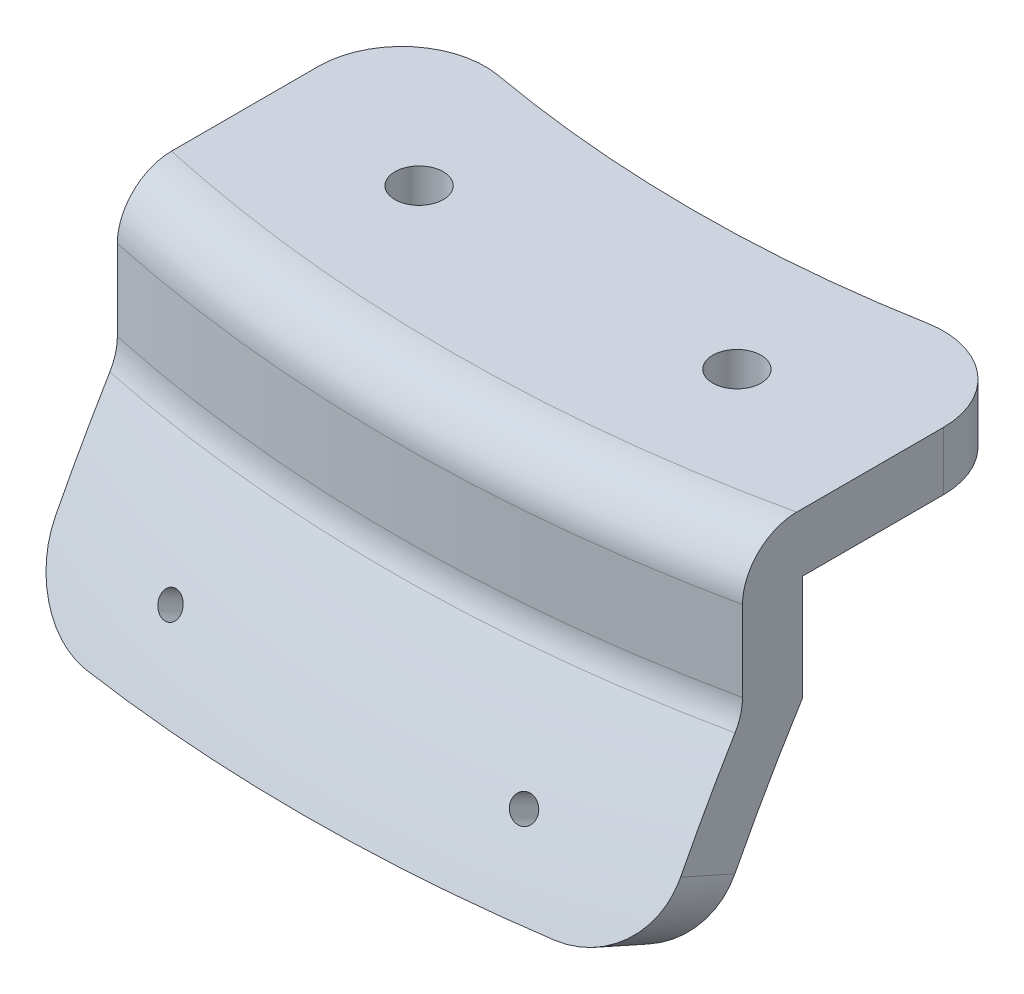
from build123d import *

# Parameters (mm, degrees)
REVOLVE1_ANGLE      = 30
FILLET1_R           = 6.35
SKETCH3_R           = 2.9
CUT_EXTRUDE1_DEPTH  = 203.397131238
SKETCH4_OUTSIDE_W   = 125.116
SKETCH4_OUTSIDE_H   = 77.698
SKETCH4_OUTSIDE_W_2 = 74.947346354
SKETCH4_OUTSIDE_H_2 = 51.780385927
CUT_EXTRUDE2_DEPTH  = 203.397131238
FILLET2_R           = 10


with BuildPart() as part:
    # Sketch2 → Revolve1 (revolve, symmetric)
    with BuildSketch(Plane(origin=(0, 0, 0), x_dir=(0, 0, -1), z_dir=(1, 0, 0))) as revolve1_sk:
        with BuildLine():
            Line((-173.36215491, 191.568849685), (-173.36215491, 178.868849685))
            ThreePointArc((-173.36215491, 178.868849685), (-179.659860551, 167.80435792), (-185.252314729, 156.367202215))
            Line((-185.252314729, 156.367202215), (-191.634038169, 159.243589868))
            ThreePointArc((-191.634038169, 159.243589868), (-186.310738837, 170.195769136), (-180.36215491, 180.821308922))
            Line((-180.36215491, 180.821308922), (-180.36215491, 198.568849685))
            Line((-180.36215491, 198.568849685), (-144.78715491, 198.568849685))
            Line((-144.78715491, 198.568849685), (-144.78715491, 191.568849685))
            Line((-144.78715491, 191.568849685), (-173.36215491, 191.568849685))
        make_face()
    revolve(axis=Axis((0, 72.869777778, 0), (0, 1, 0)), revolution_arc=REVOLVE1_ANGLE / 2)
    revolve(revolve1_sk.sketch, axis=Axis((0, 72.869777778, 0), (0, -1, 0)), revolution_arc=REVOLVE1_ANGLE / 2)

    # Fillet1
    fillet1_edges = [part.edges().sort_by_distance(p)[0] for p in [
        (0, 180.821308922, 180.36215491),
        (0, 198.568849685, 180.36215491),
    ]]
    fillet(fillet1_edges, radius=FILLET1_R)

    # Sketch3 → Cut-Extrude1 (cut, through all)
    with BuildSketch(Plane.XZ.offset(-198.568849685)):
        with Locations((19.05, 158.674245572)):
            Circle(SKETCH3_R)
        with Locations((-19.05, 158.674245572)):
            Circle(SKETCH3_R)
    extrude(amount=CUT_EXTRUDE1_DEPTH, mode=Mode.SUBTRACT)

    # Sketch4 outside → Cut-Extrude2 (cut, through all)
    with BuildSketch(Plane(origin=(0, 198.568849685, 0), x_dir=(1, 0, 0), z_dir=(0, 1, 0))):
        with Locations((0, -165.744)):
            Rectangle(SKETCH4_OUTSIDE_W, SKETCH4_OUTSIDE_H)
        with Locations((0, -165.743845206)):
            Rectangle(SKETCH4_OUTSIDE_W_2, SKETCH4_OUTSIDE_H_2, mode=Mode.SUBTRACT)
    extrude(amount=-CUT_EXTRUDE2_DEPTH, mode=Mode.SUBTRACT)

    # Fillet2
    fillet2_edges = [part.edges().sort_by_distance(p)[0] for p in [
        (-37.473673177, 157.804976422, 184.678649797),
        (-37.473673177, 195.068849685, 139.853652242),
        (37.473673177, 195.068849685, 139.853652242),
        (37.473673177, 157.804976422, 184.678649797),
    ]]
    fillet(fillet2_edges, radius=FILLET2_R)

    # Sketch6 → Cut-Revolve1 (revolve, cut)
    with BuildSketch(Plane(origin=(0, 57.850779247, -29.476444299), x_dir=(0, 0.45399049973954475, 0.8910065241883689), z_dir=(0, 0.8910065241883689, -0.45399049973954475))):
        Polygon((209.17640475, 18.300564093), (275.794196508, 24.128865661), (275.663462894, 25.623157708), (209.045671136, 19.79485614), align=None)
    cut_revolve1 = revolve(axis=Axis((18.300564093, 152.814879773, 156.90109704), (0.08715574274765756, 0.45226292882455615, 0.887615975361608)), mode=Mode.SUBTRACT)

    # Mirror1: Cut-Revolve1 across plane
    add(cut_revolve1.mirror(Plane(origin=(0, 0, 0), x_dir=(0, 0, 1), z_dir=(1, 0, 0))), mode=Mode.SUBTRACT)


solid = part.part
